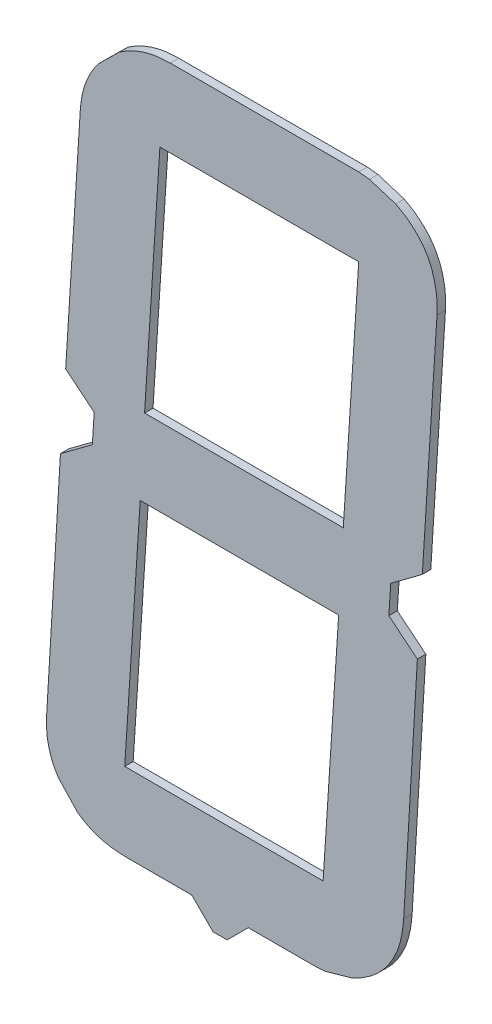
from build123d import *

# Parameters (mm, degrees)
EXTRUDE_1_DEPTH     = 1.2
EXTRUDE_1_2_DEPTH   = 1.2
EXTRUDE_1_3_DEPTH   = 1.2
EXTRUDE_1_4_DEPTH   = 1.2
EXTRUDE_1_5_DEPTH   = 1.2
EXTRUDE_1_6_DEPTH   = 1.2
EXTRUDE_1_7_DEPTH   = 1.2
CUT_EXTRUDE_START   = -1.2
CUT_EXTRUDE_1_DEPTH = 1.2
EXTRUDE_2_DEPTH     = 1.2
SKETCH_4_W          = 8
SKETCH_4_H          = 3
EXTRUDE_3_DEPTH     = 1.2
CHAMFER_1_SIZE      = 3


# Read off the part's stored shape, not the designer's step: Вырез-Вытянуть-Тонкостенный1
with BuildPart() as part:
    # Эскиз1 → Бобышка-Вытянуть1 (new body)
    with BuildSketch(Plane.XY):
        with BuildLine():
            Line((48.715381083, 89.326618208), (25.633974438, 89.326618208))
            Line((25.633974438, 89.326618208), (16.424726332, 98.90501339))
            add(Edge.make_bspline(
                [(16.424726332, 98.90501339), (17.046442876, 99.341649928), (18.267344562, 100.199099019), (20.315095034, 101.097084096), (22.468240975, 101.668181371), (23.953020919, 101.729925319), (24.701392351, 101.76104603)],
                knots=[0, 0, 0, 0, 1.020658978, 2.004328627, 2.994124718, 4, 4, 4, 4], degree=3))
            Line((24.701392351, 101.76104603), (51.474269756, 101.76104603))
            Line((51.474269756, 101.76104603), (53.96115532, 101.508471715))
            Line((53.96115532, 101.508471715), (48.715381083, 89.326618208))
        make_face()
    extrude(amount=EXTRUDE_1_DEPTH)


with BuildPart() as body_2:
    # Эскиз1 → Extrude 1 2 (new body)
    with BuildSketch(Plane.XY):
        with BuildLine():
            Line((50.522258876, 87.034020578), (56.292610537, 100.711891183))
            add(Edge.make_bspline(
                [(56.292610537, 100.711891183), (56.872426459, 100.424489235), (57.992774107, 99.869157649), (59.468715814, 98.779028645), (60.7115741, 97.54513856), (61.719561272, 96.151707655), (62.467267736, 94.583389711), (62.961857151, 92.863872855), (63.249109501, 90.9875998), (63.222892422, 89.690287211), (63.209261013, 89.015757512)],
                knots=[0, 0, 0, 0, 1.065948377, 2.059675685, 3.011626956, 3.94566096, 4.882319089, 5.862745984, 6.888747923, 8, 8, 8, 8], degree=3))
            Line((63.209261013, 89.015757512), (61.110951318, 55.811949469))
            Line((61.110951318, 55.811949469), (56.661757613, 52.489625785))
            Line((56.661757613, 52.489625785), (48.695952289, 58.862270044))
            Line((48.695952289, 58.862270044), (50.522258876, 87.034020578))
        make_face()
    extrude(amount=EXTRUDE_1_2_DEPTH)


with BuildPart() as body_3:
    # Эскиз1 → Extrude 1 3 (new body)
    with BuildSketch(Plane.XY):
        with BuildLine():
            Line((47.705083822, 42.678085082), (56.389754504, 49.070158134))
            Line((56.389754504, 49.070158134), (60.45037234, 45.74783445))
            Line((60.45037234, 45.74783445), (58.488064199, 12.5634552))
            add(Edge.make_bspline(
                [(58.488064199, 12.5634552), (58.420496696, 11.874587816), (58.28970777, 10.541162419), (57.823949094, 8.625296868), (57.098173468, 6.888651889), (56.155918884, 5.305629758), (54.972806214, 3.892910011), (53.56092009, 2.640506095), (51.90764089, 1.560277715), (50.685929609, 1.000522637), (50.055967832, 0.711891183)],
                knots=[0, 0, 0, 0, 1.076355317, 2.083477241, 3.054916997, 3.995219207, 4.939832775, 5.910749548, 6.922701339, 8, 8, 8, 8], degree=3))
            Line((50.055967832, 0.711891183), (45.859348442, 14.428619374))
            Line((45.859348442, 14.428619374), (47.705083822, 42.678085082))
        make_face()
    extrude(amount=EXTRUDE_1_3_DEPTH)


with BuildPart() as body_4:
    # Эскиз1 → Extrude 1 4 (new body)
    with BuildSketch(Plane.XY):
        with BuildLine():
            Line((20.815633657, 12.233165711), (43.877611508, 12.233165711))
            Line((43.877611508, 12.233165711), (47.549653474, -0.065260556))
            Line((47.549653474, -0.065260556), (45.06276791, -0.201262111))
            Line((45.06276791, -0.201262111), (18.328748093, -0.201262111))
            add(Edge.make_bspline(
                [(18.328748093, -0.201262111), (17.587342725, -0.16790088), (16.138327284, -0.102699115), (14.051390965, 0.415320239), (12.125296995, 1.268374835), (11.016129357, 2.10124066), (10.460086737, 2.518768975)],
                knots=[0, 0, 0, 0, 1.046522757, 2.045342129, 3.020100256, 4, 4, 4, 4], degree=3))
            Line((10.460086737, 2.518768975), (20.815633657, 12.233165711))
        make_face()
    extrude(amount=EXTRUDE_1_4_DEPTH)


with BuildPart() as body_5:
    # Эскиз1 → Extrude 1 5 (new body)
    with BuildSketch(Plane.XY):
        with BuildLine():
            Line((19.144757418, 14.253760232), (8.750352911, 4.383933149))
            add(Edge.make_bspline(
                [(8.750352911, 4.383933149), (8.347830199, 4.971791124), (7.548998065, 6.138432973), (6.823323675, 8.155816029), (6.434028016, 10.301026142), (6.488276416, 11.771820349), (6.516041662, 12.524597613)],
                knots=[0, 0, 0, 0, 0.987067533, 1.958898816, 2.955330013, 4, 4, 4, 4], degree=3))
            Line((6.516041662, 12.524597613), (8.478349802, 45.728405657))
            Line((8.478349802, 45.728405657), (12.985829888, 49.070158134))
            Line((12.985829888, 49.070158134), (20.990492798, 42.658656288))
            Line((20.990492798, 42.658656288), (19.144757418, 14.253760232))
        make_face()
    extrude(amount=EXTRUDE_1_5_DEPTH)


with BuildPart() as body_6:
    # Эскиз1 → Extrude 1 6 (new body)
    with BuildSketch(Plane.XY):
        with BuildLine():
            Line((21.942503678, 58.881698837), (13.238404203, 52.489625785))
            Line((13.238404203, 52.489625785), (9.177786367, 55.811949469))
            Line((9.177786367, 55.811949469), (11.276096062, 89.054615099))
            add(Edge.make_bspline(
                [(11.276096062, 89.054615099), (11.352568907, 89.792004626), (11.503633208, 91.248642381), (12.205959169, 93.332866685), (13.177672166, 95.318642991), (14.120219983, 96.460520121), (14.598419746, 97.039849216)],
                knots=[0, 0, 0, 0, 1.007070456, 1.989364909, 2.979908279, 4, 4, 4, 4], degree=3))
            Line((14.598419746, 97.039849216), (23.768810265, 87.189450926))
            Line((23.768810265, 87.189450926), (21.942503678, 58.881698837))
        make_face()
    extrude(amount=EXTRUDE_1_6_DEPTH)


with BuildPart() as body_7:
    # Эскиз1 → Extrude 1 7 (new body)
    with BuildSketch(Plane.XY):
        Polygon((14.948138029, 50.77989196), (23.613379917, 56.997105871), (46.811359323, 56.997105871), (54.680020679, 50.77989196), (46.034207584, 44.562678049), (22.816799385, 44.562678049), align=None)
    extrude(amount=EXTRUDE_1_7_DEPTH)


with BuildPart() as cut_extrude_1_tool:
    # Вырез-Вытянуть-Тонкостенный1 outline → Вырез-Вытянуть-Тонкостенный1 (new body)
    # profile 1 of 7: a face of its own
    with BuildSketch(Plane.XY.offset(1.2).offset(CUT_EXTRUDE_START)):
        with BuildLine():
            add(Edge.make_bspline(
                [(16.424726332, 98.90501339), (17.046442876, 99.341649928), (18.267344562, 100.199099019), (20.315095034, 101.097084096), (22.468240975, 101.668181371), (23.953020919, 101.729925319), (24.701392351, 101.76104603)],
                knots=[0, 0, 0, 0, 0.255164744, 0.501082157, 0.74853118, 1, 1, 1, 1], degree=3))
            Line((16.424726332, 98.90501339), (25.633974438, 89.326618208))
            Line((25.633974438, 89.326618208), (48.715381083, 89.326618208))
            Line((48.715381083, 89.326618208), (53.96115532, 101.508471715))
            Line((53.96115532, 101.508471715), (51.474269756, 101.76104603))
            Line((51.474269756, 101.76104603), (24.701392351, 101.76104603))
        make_face()
        with BuildLine():
            add(Edge.make_bspline(
                [(24.715941202, 101.06104603), (24.073440985, 101.034324979), (23.430886148, 101.008238304), (22.474393504, 100.88386239), (22.156175981, 100.826220075), (21.532137699, 100.683185135), (21.225013046, 100.59813608), (20.315786313, 100.309405985), (19.724576172, 100.075612456), (18.865147168, 99.649208655), (18.582909623, 99.492741509), (18.032739645, 99.157865771), (17.763926458, 98.980519597), (17.497832435, 98.79887764)],
                knots=[0, 0, 0, 0, 0.25, 0.25, 0.375, 0.375, 0.5, 0.5, 0.75, 0.75, 0.875, 0.875, 1, 1, 1, 1], degree=3))
            Line((24.715941202, 101.06104603), (51.438814077, 101.06104603))
            Line((51.438814077, 101.06104603), (52.940656917, 100.908515117))
            Line((52.940656917, 100.908515117), (48.254672603, 90.026618208))
            Line((48.254672603, 90.026618208), (25.932012903, 90.026618208))
            Line((25.932012903, 90.026618208), (17.497832435, 98.79887764))
        make_face(mode=Mode.SUBTRACT)
    # profile 2 of 7: a face of its own
    with BuildSketch(Plane.XY.offset(1.2).offset(CUT_EXTRUDE_START)):
        with BuildLine():
            add(Edge.make_bspline(
                [(58.488064199, 12.5634552), (58.420496696, 11.874587816), (58.28970777, 10.541162419), (57.823949094, 8.625296868), (57.098173468, 6.888651889), (56.155918884, 5.305629758), (54.972806214, 3.892910011), (53.56092009, 2.640506095), (51.90764089, 1.560277715), (50.685929609, 1.000522637), (50.055967832, 0.711891183)],
                knots=[0, 0, 0, 0, 0.134544415, 0.260434655, 0.381864625, 0.499402401, 0.617479097, 0.738843694, 0.865337667, 1, 1, 1, 1], degree=3))
            Line((58.488064199, 12.5634552), (60.45037234, 45.74783445))
            Line((60.45037234, 45.74783445), (56.389754504, 49.070158134))
            Line((56.389754504, 49.070158134), (47.705083822, 42.678085082))
            Line((47.705083822, 42.678085082), (45.859348442, 14.428619374))
            Line((45.859348442, 14.428619374), (50.055967832, 0.711891183))
        make_face()
        with BuildLine():
            add(Edge.make_bspline(
                [(50.490477038, 1.684339901), (51.016803061, 1.932934245), (51.533598279, 2.195809917), (52.51798996, 2.795282573), (52.988546029, 3.127444771), (53.883987055, 3.860204526), (54.311901532, 4.26460134), (55.090762842, 5.120051505), (55.44412253, 5.572957078), (56.074950898, 6.531746368), (56.354011587, 7.036518731), (56.722187981, 7.828870826), (56.835838323, 8.098504952), (57.041125652, 8.641174625), (57.133136752, 8.915309199), (57.377976964, 9.745926597), (57.500043582, 10.310509714), (57.676250384, 11.457562148), (57.733227854, 12.03865129), (57.79008471, 12.6183025)],
                knots=[0, 0, 0, 0, 0.125, 0.125, 0.25, 0.25, 0.375, 0.375, 0.5, 0.5, 0.625, 0.625, 0.6875, 0.6875, 0.75, 0.75, 0.875, 0.875, 1, 1, 1, 1], degree=3))
            Line((50.490477038, 1.684339901), (46.566214612, 14.510864312))
            Line((46.566214612, 14.510864312), (48.382357411, 42.307407778))
            Line((48.382357411, 42.307407778), (56.367054799, 48.184287958))
            Line((56.367054799, 48.184287958), (59.73049572, 45.43238175))
            Line((59.73049572, 45.43238175), (57.79008471, 12.6183025))
        make_face(mode=Mode.SUBTRACT)
    # profile 3 of 7: a face of its own
    with BuildSketch(Plane.XY.offset(1.2).offset(CUT_EXTRUDE_START)):
        with BuildLine():
            add(Edge.make_bspline(
                [(18.328748093, -0.201262111), (17.587342725, -0.16790088), (16.138327284, -0.102699115), (14.051390965, 0.415320239), (12.125296995, 1.268374835), (11.016129357, 2.10124066), (10.460086737, 2.518768975)],
                knots=[0, 0, 0, 0, 0.261630689, 0.511335532, 0.755025064, 1, 1, 1, 1], degree=3))
            Line((18.328748093, -0.201262111), (45.06276791, -0.201262111))
            Line((45.06276791, -0.201262111), (47.549653474, -0.065260556))
            Line((47.549653474, -0.065260556), (43.877611508, 12.233165711))
            Line((43.877611508, 12.233165711), (20.815633657, 12.233165711))
            Line((20.815633657, 12.233165711), (10.460086737, 2.518768975))
        make_face()
        with BuildLine():
            add(Edge.make_bspline(
                [(11.550470184, 2.5818496), (11.795867518, 2.404685246), (12.04441495, 2.232941282), (12.55541981, 1.913388359), (12.818645158, 1.766900763), (13.360505008, 1.500440183), (13.639861318, 1.37962177), (14.203014591, 1.163782269), (14.487530387, 1.067995459), (15.349461212, 0.815242091), (15.935710043, 0.694741726), (17.132291051, 0.553157757), (17.739582498, 0.525960144), (18.34448977, 0.498737889)],
                knots=[0, 0, 0, 0, 0.125, 0.125, 0.25, 0.25, 0.375, 0.375, 0.5, 0.5, 0.75, 0.75, 1, 1, 1, 1], degree=3))
            Line((11.550470184, 2.5818496), (21.092573159, 11.533165711))
            Line((21.092573159, 11.533165711), (43.356080156, 11.533165711))
            Line((43.356080156, 11.533165711), (46.624900169, 0.585212969))
            Line((46.624900169, 0.585212969), (45.043641575, 0.498737889))
            Line((45.043641575, 0.498737889), (18.34448977, 0.498737889))
        make_face(mode=Mode.SUBTRACT)
    # profile 4 of 7: a face of its own
    with BuildSketch(Plane.XY.offset(1.2).offset(CUT_EXTRUDE_START)):
        with BuildLine():
            add(Edge.make_bspline(
                [(8.750352911, 4.383933149), (8.347830199, 4.971791124), (7.548998065, 6.138432973), (6.823323675, 8.155816029), (6.434028016, 10.301026142), (6.488276416, 11.771820349), (6.516041662, 12.524597613)],
                knots=[0, 0, 0, 0, 0.246766883, 0.489724704, 0.738832503, 1, 1, 1, 1], degree=3))
            Line((8.750352911, 4.383933149), (19.144757418, 14.253760232))
            Line((19.144757418, 14.253760232), (20.990492798, 42.658656288))
            Line((20.990492798, 42.658656288), (12.985829888, 49.070158134))
            Line((12.985829888, 49.070158134), (8.478349802, 45.728405657))
            Line((8.478349802, 45.728405657), (6.516041662, 12.524597613))
        make_face()
        with BuildLine():
            add(Edge.make_bspline(
                [(7.215280083, 12.491044523), (7.192593087, 11.875928134), (7.169240469, 11.260808285), (7.208484477, 10.338514623), (7.235652525, 10.030169922), (7.318423295, 9.422710186), (7.373272427, 9.122636757), (7.572996989, 8.231969766), (7.747788139, 7.649500612), (8.100031678, 6.800254206), (8.234732821, 6.520587684), (8.534633236, 5.98098186), (8.698262824, 5.719148815), (8.86783246, 5.460776557)],
                knots=[0, 0, 0, 0, 0.25, 0.25, 0.375, 0.375, 0.5, 0.5, 0.75, 0.75, 0.875, 0.875, 1, 1, 1, 1], degree=3))
            Line((7.215280083, 12.491044523), (9.157844696, 45.360776429))
            Line((9.157844696, 45.360776429), (12.969316506, 48.186522772))
            Line((12.969316506, 48.186522772), (20.268325319, 42.340229305))
            Line((20.268325319, 42.340229305), (18.464002717, 14.572654109))
            Line((18.464002717, 14.572654109), (8.86783246, 5.460776557))
        make_face(mode=Mode.SUBTRACT)
    # profile 5 of 7: a face of its own
    with BuildSketch(Plane.XY.offset(1.2).offset(CUT_EXTRUDE_START)):
        with BuildLine():
            add(Edge.make_bspline(
                [(56.292610537, 100.711891183), (56.872426459, 100.424489235), (57.992774107, 99.869157649), (59.468715814, 98.779028645), (60.7115741, 97.54513856), (61.719561272, 96.151707655), (62.467267736, 94.583389711), (62.961857151, 92.863872855), (63.249109501, 90.9875998), (63.222892422, 89.690287211), (63.209261013, 89.015757512)],
                knots=[0, 0, 0, 0, 0.133243547, 0.257459461, 0.376453369, 0.49320762, 0.610289886, 0.732843248, 0.86109349, 1, 1, 1, 1], degree=3))
            Line((56.292610537, 100.711891183), (50.522258876, 87.034020578))
            Line((50.522258876, 87.034020578), (48.695952289, 58.862270044))
            Line((48.695952289, 58.862270044), (56.661757613, 52.489625785))
            Line((56.661757613, 52.489625785), (61.110951318, 55.811949469))
            Line((61.110951318, 55.811949469), (63.209261013, 89.015757512))
        make_face()
        with BuildLine():
            add(Edge.make_bspline(
                [(62.509707325, 89.044916143), (62.520655005, 89.586777516), (62.531614092, 90.128640554), (62.486925974, 91.202640138), (62.425532622, 91.733937577), (62.233275726, 92.786387746), (62.106497215, 93.308137014), (61.857452254, 94.0821631), (61.76367931, 94.339939524), (61.554525349, 94.845784711), (61.439952755, 95.092551689), (61.065159761, 95.813715522), (60.772410336, 96.268079972), (60.10629843, 97.127164795), (59.731552001, 97.532731648), (58.936371123, 98.273695822), (58.514205064, 98.614488539), (57.840773045, 99.07713333), (57.608626021, 99.22292192), (57.133319735, 99.497043126), (56.891187647, 99.625934561), (56.647043471, 99.75115614)],
                knots=[0, 0, 0, 0, 0.125, 0.125, 0.25, 0.25, 0.375, 0.375, 0.4375, 0.4375, 0.5, 0.5, 0.625, 0.625, 0.75, 0.75, 0.875, 0.875, 0.9375, 0.9375, 1, 1, 1, 1], degree=3))
            Line((62.509707325, 89.044916143), (60.432760377, 56.179153792))
            Line((60.432760377, 56.179153792), (56.676505558, 53.374264822))
            Line((56.676505558, 53.374264822), (49.418084276, 59.181001848))
            Line((49.418084276, 59.181001848), (51.213147748, 86.870810722))
            Line((51.213147748, 86.870810722), (56.647043471, 99.75115614))
        make_face(mode=Mode.SUBTRACT)
    # profile 6 of 7: a face of its own
    with BuildSketch(Plane.XY.offset(1.2).offset(CUT_EXTRUDE_START)):
        with BuildLine():
            add(Edge.make_bspline(
                [(11.276096062, 89.054615099), (11.352568907, 89.792004626), (11.503633208, 91.248642381), (12.205959169, 93.332866685), (13.177672166, 95.318642991), (14.120219983, 96.460520121), (14.598419746, 97.039849216)],
                knots=[0, 0, 0, 0, 0.251767614, 0.497341227, 0.74497707, 1, 1, 1, 1], degree=3))
            Line((11.276096062, 89.054615099), (9.177786367, 55.811949469))
            Line((9.177786367, 55.811949469), (13.238404203, 52.489625785))
            Line((13.238404203, 52.489625785), (21.942503678, 58.881698837))
            Line((21.942503678, 58.881698837), (23.768810265, 87.189450926))
            Line((23.768810265, 87.189450926), (14.598419746, 97.039849216))
        make_face()
        with BuildLine():
            add(Edge.make_bspline(
                [(14.632841243, 95.975566267), (14.434797367, 95.728005104), (14.241625925, 95.477226659), (13.877903829, 94.960733196), (13.708791385, 94.694068524), (13.398026362, 94.142607351), (13.255091928, 93.858038457), (12.991155221, 93.281622928), (12.869195506, 92.989330109), (12.530104488, 92.101518005), (12.343911454, 91.491441144), (12.103625715, 90.253812557), (12.03901401, 89.62507322), (11.973817002, 88.996438494)],
                knots=[0, 0, 0, 0, 0.125, 0.125, 0.25, 0.25, 0.375, 0.375, 0.5, 0.5, 0.75, 0.75, 1, 1, 1, 1], degree=3))
            Line((14.632841243, 95.975566267), (23.05083291, 86.933359116))
            Line((23.05083291, 86.933359116), (21.264978981, 59.252623217))
            Line((21.264978981, 59.252623217), (13.261566694, 53.375117319))
            Line((13.261566694, 53.375117319), (9.899021021, 56.126291051))
            Line((9.899021021, 56.126291051), (11.973817002, 88.996438494))
        make_face(mode=Mode.SUBTRACT)
    # profile 7 of 7: a face of its own
    with BuildSketch(Plane.XY.offset(1.2).offset(CUT_EXTRUDE_START)):
        Polygon((23.613379917, 56.997105871), (14.948138029, 50.77989196), (22.816799385, 44.562678049), (46.034207584, 44.562678049), (54.680020679, 50.77989196), (46.811359323, 56.997105871), align=None)
        Polygon((16.111349946, 50.752945787), (23.838523063, 56.297105871), (46.568188655, 56.297105871), (53.517615169, 50.806200971), (45.808653605, 45.262678049), (23.059970052, 45.262678049), align=None, mode=Mode.SUBTRACT)
    extrude(amount=CUT_EXTRUDE_1_DEPTH)


with BuildPart() as part_1:
    add(part.part)

    # Вырез-Вытянуть-Тонкостенный1: cut by cut_extrude_1_tool
    add(cut_extrude_1_tool.part, mode=Mode.SUBTRACT)



with BuildPart() as body_2_1:
    add(body_2.part)

    # Вырез-Вытянуть-Тонкостенный1: cut by cut_extrude_1_tool
    add(cut_extrude_1_tool.part, mode=Mode.SUBTRACT)


with BuildPart() as body_3_1:
    add(body_3.part)

    # Вырез-Вытянуть-Тонкостенный1: cut by cut_extrude_1_tool
    add(cut_extrude_1_tool.part, mode=Mode.SUBTRACT)


with BuildPart() as body_4_1:
    add(body_4.part)

    # Вырез-Вытянуть-Тонкостенный1: cut by cut_extrude_1_tool
    add(cut_extrude_1_tool.part, mode=Mode.SUBTRACT)


with BuildPart() as body_5_1:
    add(body_5.part)

    # Вырез-Вытянуть-Тонкостенный1: cut by cut_extrude_1_tool
    add(cut_extrude_1_tool.part, mode=Mode.SUBTRACT)


with BuildPart() as body_6_1:
    add(body_6.part)

    # Вырез-Вытянуть-Тонкостенный1: cut by cut_extrude_1_tool
    add(cut_extrude_1_tool.part, mode=Mode.SUBTRACT)


with BuildPart() as body_7_1:
    add(body_7.part)

    # Вырез-Вытянуть-Тонкостенный1: cut by cut_extrude_1_tool
    add(cut_extrude_1_tool.part, mode=Mode.SUBTRACT)


with BuildPart() as part_2:
    add(part_1.part)

    add(body_2_1.part)  # Бобышка-Вытянуть2 merges body 2

    add(body_3_1.part)  # Бобышка-Вытянуть2 merges body 3

    add(body_4_1.part)  # Бобышка-Вытянуть2 merges body 4

    add(body_5_1.part)  # Бобышка-Вытянуть2 merges body 5

    add(body_6_1.part)  # Бобышка-Вытянуть2 merges body 6

    add(body_7_1.part)  # Бобышка-Вытянуть2 merges body 7
    # Эскиз3 → Бобышка-Вытянуть2 (add)
    with BuildSketch(Plane.XY.offset(1.2)):
        Polygon((23.250398012, 90.026618208), (23.06040377, 87.081707459), (23.05083291, 86.933359116), (14.632841243, 95.975566267), (17.497832435, 98.79887764), (25.932012903, 90.026618208), align=None)
        Polygon((48.254672603, 90.026618208), (51.41773113, 90.026618208), (51.213147748, 86.870810722), (56.647043471, 99.75115614), (52.940656917, 100.908515117), align=None)
        Polygon((13.677938559, 48.7118805), (13.937384418, 52.822175544), (13.261566694, 53.375117319), (21.264978981, 59.252623217), (21.074300442, 56.297105871), (23.838523063, 56.297105871), (16.111349946, 50.752945787), (23.059970052, 45.262678049), (20.458224519, 45.262678049), (20.268325319, 42.340229305), (12.969316506, 48.186522772), align=None)
        Polygon((8.86783246, 5.460776557), (18.464002717, 14.572654109), (18.266498341, 11.533165711), (21.092573159, 11.533165711), (11.550470184, 2.5818496), align=None)
        Polygon((46.566214612, 14.510864312), (50.490477038, 1.684339901), (46.624900169, 0.585212969), (43.356080156, 11.533165711), (46.371660715, 11.533165711), align=None)
        Polygon((49.418084276, 59.181001848), (56.676505558, 53.374264822), (55.950218762, 52.831928394), (55.691444183, 48.73706028), (56.367054799, 48.184287958), (48.382357411, 42.307407778), (48.575445909, 45.262678049), (45.808653605, 45.262678049), (53.517615169, 50.806200971), (46.568188655, 56.297105871), (49.231128261, 56.297105871), align=None)
    extrude(amount=-EXTRUDE_2_DEPTH)

    # Эскиз4 → Бобышка-Вытянуть3 (add)
    with BuildSketch(Plane.XY.offset(1.2)):
        with Locations((31.771660715, -1.001262111)):
            Rectangle(SKETCH_4_W, SKETCH_4_H)
    extrude(amount=-EXTRUDE_3_DEPTH)

    # Фаска1
    chamfer_1_edges = [part_2.edges().sort_by_distance(p)[0] for p in [
        (35.771660715, -2.501262111, 0.6),
        (27.771660715, -2.501262111, 0.6),
    ]]
    chamfer(chamfer_1_edges, length=CHAMFER_1_SIZE - 0.0001)  # a hair under: the kernel refuses the full size


solid = part_2.part
